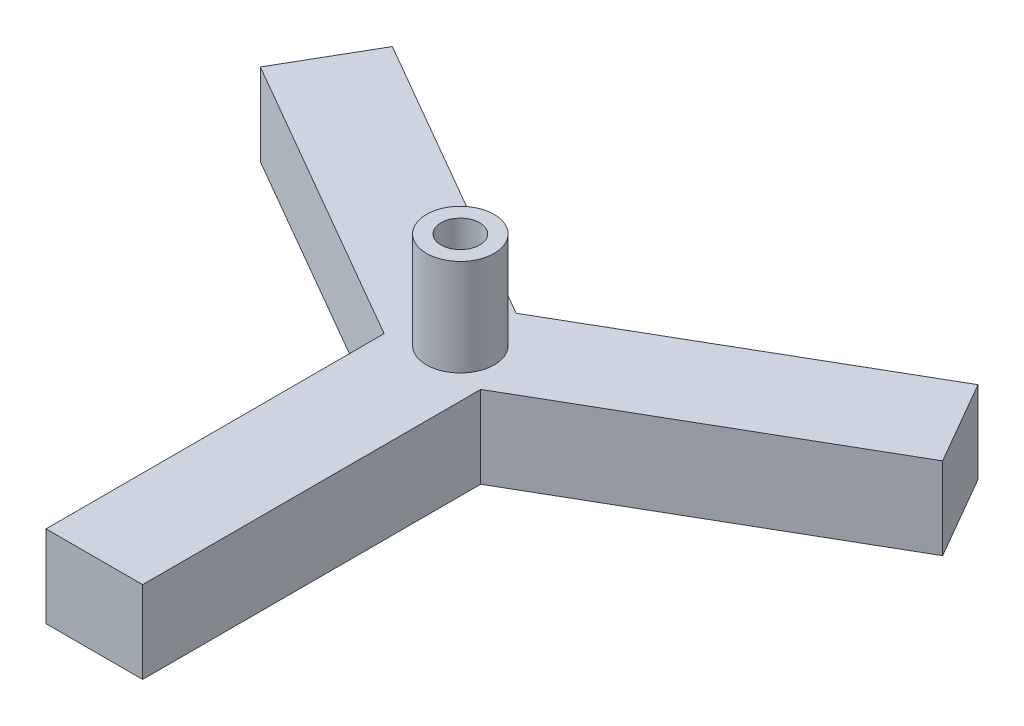
from build123d import *

# Parameters (mm, degrees)
EXTRUDE_1_DEPTH                  = 18
CUT_EXTRUDE_1_DEPTH              = 15
SKETCH_3_R                       = 4
EXTRUDE_5_DEPTH                  = 40
EXTRUDE_6_DEPTH                  = 5
EXTRUDE_7_DEPTH                  = 13.5
PATTERN_LINEAR_1_COUNT           = 8
PATTERN_LINEAR_1_PITCH           = 8.5
PATTERN_CIRCULAR_1_COUNT         = 3
PATTERN_CIRCULAR_1_COPY_1_DEPTH  = 13.5
PATTERN_CIRCULAR_1_COPY_2_DEPTH  = 13.5
PATTERN_CIRCULAR_1_COPY_3_DEPTH  = 13.5
PATTERN_CIRCULAR_1_COPY_4_DEPTH  = 13.5
PATTERN_CIRCULAR_1_COPY_5_DEPTH  = 13.5
PATTERN_CIRCULAR_1_COPY_6_DEPTH  = 13.5
PATTERN_CIRCULAR_1_COPY_7_DEPTH  = 13.5
PATTERN_CIRCULAR_1_COPY_8_DEPTH  = 13.5
PATTERN_CIRCULAR_1_COPY_9_DEPTH  = 13.5
PATTERN_CIRCULAR_1_COPY_10_DEPTH = 13.5
PATTERN_CIRCULAR_1_COPY_11_DEPTH = 13.5
PATTERN_CIRCULAR_1_COPY_12_DEPTH = 13.5
PATTERN_CIRCULAR_1_COPY_13_DEPTH = 13.5
PATTERN_CIRCULAR_1_COPY_14_DEPTH = 13.5
EXTRUDE_8_DEPTH                  = 18
EXTRUDE_9_DEPTH                  = 2
SKETCH_8_R                       = 7
SKETCH_8_R_2                     = 4
EXTRUDE_10_DEPTH                 = 20


with BuildPart() as part:
    # 草图1 → 凸台-拉伸1 (new body)
    with BuildSketch(Plane(origin=(0, 0, 0), x_dir=(1, 0, 0), z_dir=(0, 1, 0))):
        Polygon((12.00051402, -78.9285), (-12.00051402, -78.9285), (-12.00051402, -6.9285), (-74.354343093, 29.0715), (-62.353829072, 49.857), (0, 13.857), (62.353829072, 49.857), (74.354343093, 29.0715), (12.00051402, -6.9285), align=None)
    extrude(amount=EXTRUDE_1_DEPTH)

    # 草图2 → 切除-拉伸1 (cut)
    with BuildSketch(Plane(origin=(0, 18, 0), x_dir=(1, 0, 0), z_dir=(0, 1, 0))):
        Polygon((0, 11.5473), (-60.621778265, 46.5473), (-70.62203341, 29.22635), (-10.000255145, -5.77365), (-10.000255145, -75.77365), (10.000255145, -75.77365), (10.000255145, -5.77365), (70.62203341, 29.22635), (60.621778265, 46.5473), align=None)
    extrude(amount=-CUT_EXTRUDE_1_DEPTH, mode=Mode.SUBTRACT)

    # 草图3 → 凸台-拉伸5 (add)
    with BuildSketch(Plane(origin=(0, 3, 0), x_dir=(1, 0, 0), z_dir=(0, 1, 0))):
        with Locations(Location((0, 0, 0), (0, 0, 90))):
            Circle(SKETCH_3_R)
    extrude(amount=EXTRUDE_5_DEPTH)

    # 草图4 → 凸台-拉伸6 (add)
    with BuildSketch(Plane(origin=(0, 3, 0), x_dir=(1, 0, 0), z_dir=(0, 1, 0))):
        Polygon((0, 4), (59.755752861, 38.5), (63.219854476, 32.5), (3.464101615, -2), (3.464101615, -71), (-3.464101615, -71), (-3.464101615, -2), (-63.219854476, 32.5), (-59.941496442, 38.17828268), align=None)
    extrude(amount=EXTRUDE_6_DEPTH)

    # 草图5 → 凸台-拉伸7 (add)
    with BuildSketch(Plane(origin=(0, 3, 0), x_dir=(1, 0, 0), z_dir=(0, 1, 0))):
        Polygon((-3.464101615, -71), (-6.249101615, -71), (-6.249101615, -68), (6.250898385, -68), (6.250898385, -71), align=None)
    extrude_7 = extrude(amount=EXTRUDE_7_DEPTH)

    # 阵列(线性)1: 凸台-拉伸7 ×8
    with Locations(*[(0, 0, -i * PATTERN_LINEAR_1_PITCH) for i in range(1, PATTERN_LINEAR_1_COUNT)]):
        add(extrude_7)

    # 阵列(圆周)1: 凸台-拉伸7 ×3 about axis
    pattern_circular_1_axis = Axis((0, 0, 0), (0, 1, 0))
    for i in range(1, PATTERN_CIRCULAR_1_COUNT):
        add(extrude_7.rotate(pattern_circular_1_axis, i * 360 / PATTERN_CIRCULAR_1_COUNT))

    # 阵列(圆周)1 copy 1 sketch → 阵列(圆周)1 copy 1 (add)
    with BuildSketch(Plane(origin=(-7.361215932, 3, 4.25), x_dir=(-0.4999999999999998, 0, -0.8660254037844387), z_dir=(0, 1, 0))):
        Polygon((-3.464101615, -71), (-6.249101615, -71), (-6.249101615, -68), (6.250898385, -68), (6.250898385, -71), align=None)
    extrude(amount=PATTERN_CIRCULAR_1_COPY_1_DEPTH)

    # 阵列(圆周)1 copy 2 sketch → 阵列(圆周)1 copy 2 (add)
    with BuildSketch(Plane(origin=(7.361215932, 3, 4.25), x_dir=(-0.5000000000000004, 0, 0.8660254037844384), z_dir=(0, 1, 0))):
        Polygon((-3.464101615, -71), (-6.249101615, -71), (-6.249101615, -68), (6.250898385, -68), (6.250898385, -71), align=None)
    extrude(amount=PATTERN_CIRCULAR_1_COPY_2_DEPTH)

    # 阵列(圆周)1 copy 3 sketch → 阵列(圆周)1 copy 3 (add)
    with BuildSketch(Plane(origin=(-14.722431864, 3, 8.5), x_dir=(-0.4999999999999998, 0, -0.8660254037844387), z_dir=(0, 1, 0))):
        Polygon((-3.464101615, -71), (-6.249101615, -71), (-6.249101615, -68), (6.250898385, -68), (6.250898385, -71), align=None)
    extrude(amount=PATTERN_CIRCULAR_1_COPY_3_DEPTH)

    # 阵列(圆周)1 copy 4 sketch → 阵列(圆周)1 copy 4 (add)
    with BuildSketch(Plane(origin=(14.722431864, 3, 8.5), x_dir=(-0.5000000000000004, 0, 0.8660254037844384), z_dir=(0, 1, 0))):
        Polygon((-3.464101615, -71), (-6.249101615, -71), (-6.249101615, -68), (6.250898385, -68), (6.250898385, -71), align=None)
    extrude(amount=PATTERN_CIRCULAR_1_COPY_4_DEPTH)

    # 阵列(圆周)1 copy 5 sketch → 阵列(圆周)1 copy 5 (add)
    with BuildSketch(Plane(origin=(-22.083647797, 3, 12.75), x_dir=(-0.4999999999999998, 0, -0.8660254037844387), z_dir=(0, 1, 0))):
        Polygon((-3.464101615, -71), (-6.249101615, -71), (-6.249101615, -68), (6.250898385, -68), (6.250898385, -71), align=None)
    extrude(amount=PATTERN_CIRCULAR_1_COPY_5_DEPTH)

    # 阵列(圆周)1 copy 6 sketch → 阵列(圆周)1 copy 6 (add)
    with BuildSketch(Plane(origin=(22.083647797, 3, 12.75), x_dir=(-0.5000000000000004, 0, 0.8660254037844384), z_dir=(0, 1, 0))):
        Polygon((-3.464101615, -71), (-6.249101615, -71), (-6.249101615, -68), (6.250898385, -68), (6.250898385, -71), align=None)
    extrude(amount=PATTERN_CIRCULAR_1_COPY_6_DEPTH)

    # 阵列(圆周)1 copy 7 sketch → 阵列(圆周)1 copy 7 (add)
    with BuildSketch(Plane(origin=(-29.444863729, 3, 17), x_dir=(-0.4999999999999998, 0, -0.8660254037844387), z_dir=(0, 1, 0))):
        Polygon((-3.464101615, -71), (-6.249101615, -71), (-6.249101615, -68), (6.250898385, -68), (6.250898385, -71), align=None)
    extrude(amount=PATTERN_CIRCULAR_1_COPY_7_DEPTH)

    # 阵列(圆周)1 copy 8 sketch → 阵列(圆周)1 copy 8 (add)
    with BuildSketch(Plane(origin=(29.444863729, 3, 17), x_dir=(-0.5000000000000004, 0, 0.8660254037844384), z_dir=(0, 1, 0))):
        Polygon((-3.464101615, -71), (-6.249101615, -71), (-6.249101615, -68), (6.250898385, -68), (6.250898385, -71), align=None)
    extrude(amount=PATTERN_CIRCULAR_1_COPY_8_DEPTH)

    # 阵列(圆周)1 copy 9 sketch → 阵列(圆周)1 copy 9 (add)
    with BuildSketch(Plane(origin=(-36.806079661, 3, 21.25), x_dir=(-0.4999999999999998, 0, -0.8660254037844387), z_dir=(0, 1, 0))):
        Polygon((-3.464101615, -71), (-6.249101615, -71), (-6.249101615, -68), (6.250898385, -68), (6.250898385, -71), align=None)
    extrude(amount=PATTERN_CIRCULAR_1_COPY_9_DEPTH)

    # 阵列(圆周)1 copy 10 sketch → 阵列(圆周)1 copy 10 (add)
    with BuildSketch(Plane(origin=(36.806079661, 3, 21.25), x_dir=(-0.5000000000000004, 0, 0.8660254037844384), z_dir=(0, 1, 0))):
        Polygon((-3.464101615, -71), (-6.249101615, -71), (-6.249101615, -68), (6.250898385, -68), (6.250898385, -71), align=None)
    extrude(amount=PATTERN_CIRCULAR_1_COPY_10_DEPTH)

    # 阵列(圆周)1 copy 11 sketch → 阵列(圆周)1 copy 11 (add)
    with BuildSketch(Plane(origin=(-44.167295593, 3, 25.5), x_dir=(-0.4999999999999998, 0, -0.8660254037844387), z_dir=(0, 1, 0))):
        Polygon((-3.464101615, -71), (-6.249101615, -71), (-6.249101615, -68), (6.250898385, -68), (6.250898385, -71), align=None)
    extrude(amount=PATTERN_CIRCULAR_1_COPY_11_DEPTH)

    # 阵列(圆周)1 copy 12 sketch → 阵列(圆周)1 copy 12 (add)
    with BuildSketch(Plane(origin=(44.167295593, 3, 25.5), x_dir=(-0.5000000000000004, 0, 0.8660254037844384), z_dir=(0, 1, 0))):
        Polygon((-3.464101615, -71), (-6.249101615, -71), (-6.249101615, -68), (6.250898385, -68), (6.250898385, -71), align=None)
    extrude(amount=PATTERN_CIRCULAR_1_COPY_12_DEPTH)

    # 阵列(圆周)1 copy 13 sketch → 阵列(圆周)1 copy 13 (add)
    with BuildSketch(Plane(origin=(-51.528511525, 3, 29.75), x_dir=(-0.4999999999999998, 0, -0.8660254037844387), z_dir=(0, 1, 0))):
        Polygon((-3.464101615, -71), (-6.249101615, -71), (-6.249101615, -68), (6.250898385, -68), (6.250898385, -71), align=None)
    extrude(amount=PATTERN_CIRCULAR_1_COPY_13_DEPTH)

    # 阵列(圆周)1 copy 14 sketch → 阵列(圆周)1 copy 14 (add)
    with BuildSketch(Plane(origin=(51.528511525, 3, 29.75), x_dir=(-0.5000000000000004, 0, 0.8660254037844384), z_dir=(0, 1, 0))):
        Polygon((-3.464101615, -71), (-6.249101615, -71), (-6.249101615, -68), (6.250898385, -68), (6.250898385, -71), align=None)
    extrude(amount=PATTERN_CIRCULAR_1_COPY_14_DEPTH)


with BuildPart() as body_2:
    # 草图6 → 凸台-拉伸8 (new body)
    with BuildSketch(Plane.XZ):
        Polygon((-12.00051402, 78.9285), (12.00051402, 78.9285), (12.00051402, 6.9285), (74.354343093, -29.0715), (62.353829072, -49.857), (0, -13.857), (-62.353829072, -49.857), (-74.354343093, -29.0715), (-12.00051402, 6.9285), align=None)
    extrude(amount=-EXTRUDE_8_DEPTH)

    # 相交1: read off the stored shape, not the designer's step
    # 相交1: cut part
    add(part.part, mode=Mode.SUBTRACT)

    # 草图7 → 凸台-拉伸9 (add)
    with BuildSketch(Plane(origin=(0, 3, 0), x_dir=(-1, 0, 0), z_dir=(0, -1, 0))):
        Polygon((10.000255145, -75.77365), (-10.000255145, -75.77365), (-10.000255145, -5.77365), (-70.62203341, 29.22635), (-60.621778265, 46.5473), (0, 11.5473), (60.621778265, 46.5473), (70.62203341, 29.22635), (10.000255145, -5.77365), align=None)
    extrude(amount=EXTRUDE_9_DEPTH)

    # 草图8 → 凸台-拉伸10 (add)
    with BuildSketch(Plane(origin=(0, 18, 0), x_dir=(1, 0, 0), z_dir=(0, 1, 0))):
        with Locations(Location((0, 0, 0), (0, 0, 270))):
            Circle(SKETCH_8_R)
        with Locations(Location((0, 0, 0), (0, 0, 90))):
            Circle(SKETCH_8_R_2, mode=Mode.SUBTRACT)
    extrude(amount=EXTRUDE_10_DEPTH)


solid = body_2.part
